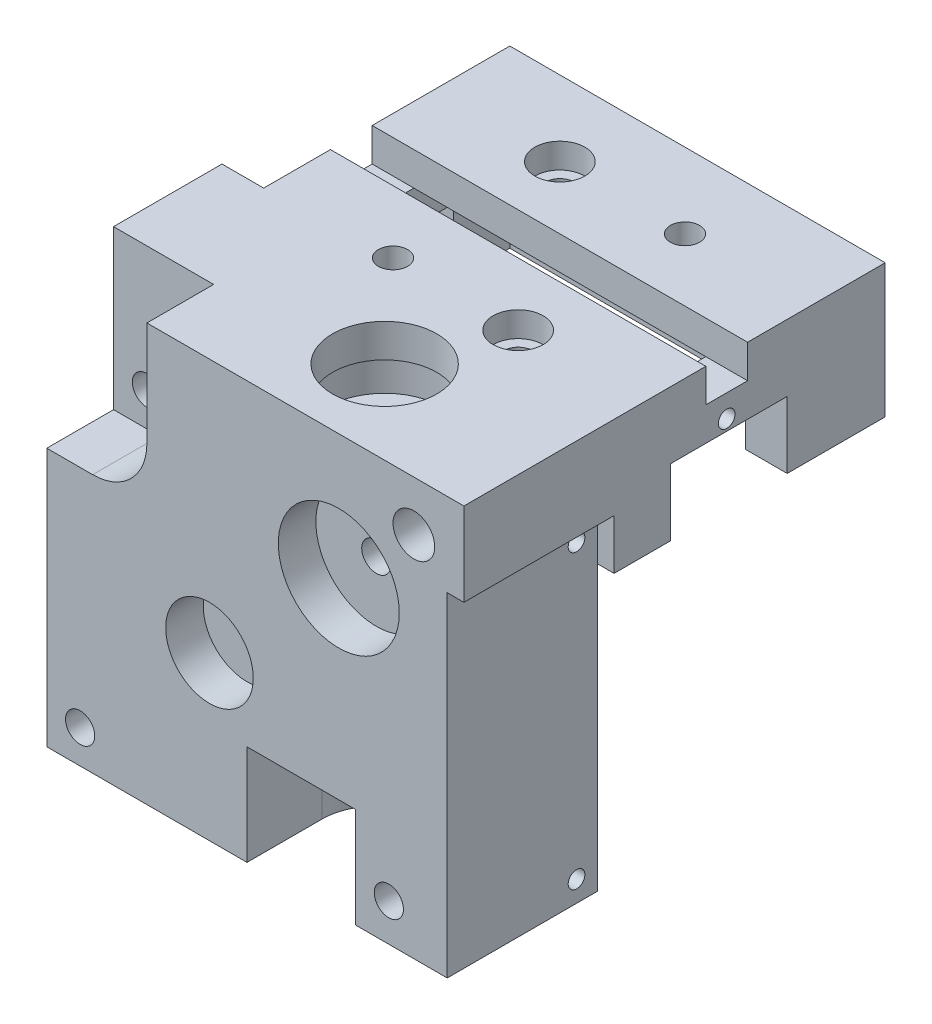
from build123d import *

# Parameters (mm, degrees)
SKETCH1_W                       = 35
SKETCH1_H                       = 28
BOSS_EXTRUDE1_DEPTH             = 4
SKETCH2_R                       = 1.75
CUT_EXTRUDE1_DEPTH              = 23.765104876
BOSS_EXTRUDE2_DEPTH             = 17.5
BOSS_EXTRUDE2_DEPTH_BACK        = 0.5
SKETCH3_W                       = 35
SKETCH3_H                       = 50
SKETCH7_W                       = 35
SKETCH7_H                       = 37
BOSS_EXTRUDE3_DEPTH             = 5
SKETCH10_R                      = 1.75
CUT_EXTRUDE6_DEPTH              = 5
SKETCH24_W                      = 18
SKETCH24_H                      = 46
BOSS_EXTRUDE4_DEPTH             = 10
SKETCH37_W                      = 13
SKETCH37_H                      = 14
BOSS_EXTRUDE9_DEPTH             = 10
CUT_EXTRUDE19_REACH             = 75.638
SKETCH22_R                      = 1.75
SKETCH22_3_R                    = 7.25
SKETCH22_3_R_2                  = 5.25
CUT_EXTRUDE20_DEPTH             = 4.5
SKETCH22_5_R                    = 1.75
SKETCH22_5_W                    = 2
SKETCH22_5_H                    = 4
CUT_EXTRUDE24_DEPTH             = 8
SKETCH22_4_W                    = 13
SKETCH22_4_H                    = 12
CUT_EXTRUDE21_DEPTH             = 15.5
FILLET3_R                       = 6.5
SKETCH26_R                      = 2.25
CUT_EXTRUDE22_DEPTH             = 57.502212346
SKETCH27_R                      = 6.25
CUT_EXTRUDE23_DEPTH             = 8
BOSS_EXTRUDE11_DEPTH            = 5
BOSS_EXTRUDE12_DEPTH            = 5
SKETCH29_R                      = 2.5
CUT_EXTRUDE25_DEPTH             = 5
CUT_EXTRUDE25_DIRECTION_2_REACH = 64.678
SKETCH55_R                      = 2.75
CUT_EXTRUDE42_DEPTH             = 10
SKETCH30_R                      = 3
CUT_EXTRUDE26_DEPTH             = 3
SKETCH38_R                      = 7
CUT_EXTRUDE31_DEPTH             = 4
SKETCH39_W                      = 5
SKETCH39_H                      = 13
SKETCH39_W_2                    = 4
SKETCH39_H_2                    = 7
CUT_EXTRUDE32_DEPTH             = 3
SKETCH40_R                      = 1.75
CUT_EXTRUDE33_DEPTH             = 15
SKETCH51_R                      = 2.5
CUT_EXTRUDE38_DEPTH             = 4
SKETCH42_R                      = 1.4
CUT_EXTRUDE34_DEPTH             = 10
SKETCH45_R                      = 1
CUT_EXTRUDE35_DEPTH             = 75.888250122
SKETCH46_R                      = 1.5
BOSS_EXTRUDE13_DEPTH            = 2.5
SKETCH48_W                      = 18
SKETCH48_H                      = 40
CUT_EXTRUDE36_DEPTH             = 2
SKETCH49_R                      = 1
CUT_EXTRUDE37_DEPTH             = 10
SKETCH53_W                      = 45
SKETCH53_H                      = 5
CUT_EXTRUDE40_DEPTH             = 4
SKETCH54_W                      = 5
SKETCH54_H                      = 21
CUT_EXTRUDE41_DEPTH             = 72.64670269
SKETCH56_R                      = 2.5
CUT_EXTRUDE43_DEPTH             = 8


with BuildPart() as part:
    # Sketch1 → Boss-Extrude1 (new body)
    with BuildSketch(Plane(origin=(0, 0, 0), x_dir=(1, 0, 0), z_dir=(0, 1, 0))):
        Rectangle(SKETCH1_W, SKETCH1_H)
    extrude(amount=BOSS_EXTRUDE1_DEPTH)

    # Sketch2 → Cut-Extrude1 (cut, through all)
    with BuildSketch(Plane(origin=(0, 4, 0), x_dir=(1, 0, 0), z_dir=(0, 1, 0))):
        with Locations(Location((-7.5, -10, 0), (0, 0, 270))):
            Circle(SKETCH2_R)
        with Locations(Location((-7.5, 10, 0), (0, 0, 270))):
            Circle(SKETCH2_R)
        with Locations(Location((7.5, -10, 0), (0, 0, 270))):
            Circle(SKETCH2_R)
        with Locations(Location((7.5, 10, 0), (0, 0, 270))):
            Circle(SKETCH2_R)
    extrude(amount=-CUT_EXTRUDE1_DEPTH, mode=Mode.SUBTRACT)

    # Sketch3 → Boss-Extrude2 (add, two sides: drawn at the far end of the back side and taken through both)
    with BuildSketch(Plane.XY.offset(14).offset(-BOSS_EXTRUDE2_DEPTH_BACK)):
        with Locations((0, -21)):
            Rectangle(SKETCH3_W, SKETCH3_H)
    extrude(amount=BOSS_EXTRUDE2_DEPTH + BOSS_EXTRUDE2_DEPTH_BACK)

    # Sketch7 → Boss-Extrude3 (add)
    with BuildSketch(Plane(origin=(0, 0, -14), x_dir=(-1, 0, 0), z_dir=(0, 0, -1))):
        with Locations((0, -14.5)):
            Rectangle(SKETCH7_W, SKETCH7_H)
    extrude(amount=BOSS_EXTRUDE3_DEPTH)

    # Sketch10 → Cut-Extrude6 (cut)
    with BuildSketch(Plane(origin=(0, 0, -19), x_dir=(-1, 0, 0), z_dir=(0, 0, -1))):
        with Locations((-5, -30)):
            Circle(SKETCH10_R)
        with Locations((5, -30)):
            Circle(SKETCH10_R)
    extrude(amount=-CUT_EXTRUDE6_DEPTH, mode=Mode.SUBTRACT)

    # Sketch24 → Boss-Extrude4 (add)
    with BuildSketch(Plane.ZY.offset(17.5)):
        with Locations((22.5, -23)):
            Rectangle(SKETCH24_W, SKETCH24_H)
    extrude(amount=BOSS_EXTRUDE4_DEPTH)

    # Sketch37 → Boss-Extrude9 (add)
    with BuildSketch(Plane.ZY.offset(17.5)):
        with Locations((17, -3)):
            Rectangle(SKETCH37_W, SKETCH37_H)
    extrude(amount=BOSS_EXTRUDE9_DEPTH)

    # Sketch22 → Cut-Extrude19 (cut, up to next)
    with BuildSketch(Plane.XY.offset(31.5), mode=Mode.PRIVATE) as cut_extrude19_sk1:
        with Locations((-23.5, -42)):
            Circle(SKETCH22_R)
    cut_extrude19_tool1 = extrude(cut_extrude19_sk1.sketch, amount=-CUT_EXTRUDE19_REACH, mode=Mode.PRIVATE) & part.part
    # Sketch22 → Cut-Extrude19 (cut, up to next)
    with BuildSketch(Plane.XY.offset(31.5), mode=Mode.PRIVATE) as cut_extrude19_sk2:
        with Locations((13.5, -41.5)):
            Circle(SKETCH22_R)
    cut_extrude19_tool2 = extrude(cut_extrude19_sk2.sketch, amount=-CUT_EXTRUDE19_REACH, mode=Mode.PRIVATE) & part.part
    # Sketch22 → Cut-Extrude19 (cut, up to next)
    with BuildSketch(Plane.XY.offset(31.5), mode=Mode.PRIVATE) as cut_extrude19_sk3:
        with Locations((7.5, -11)):
            Circle(SKETCH22_R)
    cut_extrude19_tool3 = extrude(cut_extrude19_sk3.sketch, amount=-CUT_EXTRUDE19_REACH, mode=Mode.PRIVATE) & part.part
    # Sketch22 → Cut-Extrude19 (cut, up to next)
    with BuildSketch(Plane.XY.offset(31.5), mode=Mode.PRIVATE) as cut_extrude19_sk4:
        with Locations((-23.5, -11)):
            Circle(SKETCH22_R)
    cut_extrude19_tool4 = extrude(cut_extrude19_sk4.sketch, amount=-CUT_EXTRUDE19_REACH, mode=Mode.PRIVATE) & part.part
    add(cut_extrude19_tool1.solids().sort_by_distance((-23.5, -42, 31.5))[0], mode=Mode.SUBTRACT)
    add(cut_extrude19_tool2.solids().sort_by_distance((13.5, -41.5, 31.5))[0], mode=Mode.SUBTRACT)
    add(cut_extrude19_tool3.solids().sort_by_distance((7.5, -11, 31.5))[0], mode=Mode.SUBTRACT)
    add(cut_extrude19_tool4.solids().sort_by_distance((-23.5, -11, 31.5))[0], mode=Mode.SUBTRACT)

    # Sketch22<3> → Cut-Extrude20 (cut)
    with BuildSketch(Plane.XY.offset(31.5)):
        with Locations((7.5, -11)):
            Circle(SKETCH22_3_R)
        with Locations((-8, -26.5)):
            Circle(SKETCH22_3_R_2)
    extrude(amount=-CUT_EXTRUDE20_DEPTH, mode=Mode.SUBTRACT)

    # Sketch22<5> → Cut-Extrude24 (cut)
    # profile 1 of 2: a face of its own
    with BuildSketch(Plane.XY.offset(31.5)):
        with BuildLine():
            Line((-15.5, -8.5), (-15.5, 0))
            Line((-15.5, 0), (-17.5, 0))
            Line((-17.5, 0), (-27.5, 0))
            Line((-27.5, 0), (-27.5, -15))
            Line((-27.5, -15), (-22, -15))
            ThreePointArc((-22, -15), (-17.403805922, -13.096194078), (-15.5, -8.5))
        make_face()
        with Locations((-23.5, -11)):
            Circle(SKETCH22_5_R, mode=Mode.SUBTRACT)
    # profile 2 of 2: a face of its own
    with BuildSketch(Plane.XY.offset(31.5)):
        with Locations((-16.5, 2)):
            Rectangle(SKETCH22_5_W, SKETCH22_5_H)
    extrude(amount=-CUT_EXTRUDE24_DEPTH, mode=Mode.SUBTRACT)

    # Sketch22<4> → Cut-Extrude21 (cut)
    with BuildSketch(Plane.XY.offset(31.5)):
        with Locations((3, -40)):
            Rectangle(SKETCH22_4_W, SKETCH22_4_H)
    extrude(amount=-CUT_EXTRUDE21_DEPTH, mode=Mode.SUBTRACT)

    # Fillet3
    fillet3_edges = [part.edges().sort_by_distance(p)[0] for p in [
        (9.5, -40, 16),
        (-3.5, -40, 16),
    ]]
    fillet(fillet3_edges, radius=FILLET3_R - 0.0001)  # a hair under: the kernel refuses the full size

    # Sketch26 → Cut-Extrude22 (cut, through all)
    with BuildSketch(Plane.XZ.offset(34)):
        with Locations(Location((3, 21.5, 0), (0, 0, 270))):
            Circle(SKETCH26_R)
    extrude(amount=-CUT_EXTRUDE22_DEPTH, mode=Mode.SUBTRACT)

    # Sketch27 → Cut-Extrude23 (cut)
    with BuildSketch(Plane(origin=(0, 4, 0), x_dir=(1, 0, 0), z_dir=(0, 1, 0))):
        with Locations(Location((3, -21.5, 0), (0, 0, 270))):
            Circle(SKETCH27_R)
    extrude(amount=-CUT_EXTRUDE23_DEPTH, mode=Mode.SUBTRACT)

    # Sketch43 → Boss-Extrude11 (add)
    with BuildSketch(Plane(origin=(17.5, 0, 0), x_dir=(0, 0, -1), z_dir=(1, 0, 0))):
        Polygon((-31.5, -46), (-31.5, 4), (19, 4), (19, -33), (14, -33), (14, -12), (7.25, -12), (7.25, -4), (-6.75, -4), (-6.75, -12), (-13.5, -12), (-13.5, -46), align=None)
    extrude(amount=BOSS_EXTRUDE11_DEPTH)

    # Sketch44 → Boss-Extrude12 (add)
    with BuildSketch(Plane.ZY.offset(17.5)):
        Polygon((10.5, 4), (-19, 4), (-19, -33), (-14, -33), (-14, -12), (-7.25, -12), (-7.25, -4), (6.75, -4), (6.75, -12), (13.5, -12), (13.5, -10), (10.5, -10), align=None)
    extrude(amount=BOSS_EXTRUDE12_DEPTH)

    # Sketch29 → Cut-Extrude25 (cut)
    with BuildSketch(Plane(origin=(0, 0, 13.5), x_dir=(-1, 0, 0), z_dir=(0, 0, -1))):
        with Locations(Location((-7.5, -11, 0), (0, 0, 180))):
            Circle(SKETCH29_R)
        with Locations(Location((23.5, -42, 0), (0, 0, 180))):
            Circle(SKETCH29_R)
        with Locations(Location((23.5, -11, 0), (0, 0, 203.578178478))):
            Circle(SKETCH29_R)
    extrude(amount=-CUT_EXTRUDE25_DEPTH, mode=Mode.SUBTRACT)

    # Cut-Extrude25 direction 2: up to this face of the body (flat: up to its plane)
    cut_extrude25_direction_2_end = Plane(part.part.faces().sort_by_distance((-20, -8, 6.75))[0])
    # Sketch29 → Cut-Extrude25 direction 2 (cut, up to the picked face)
    with BuildSketch(Plane(origin=(0, 0, 13.5), x_dir=(-1, 0, 0), z_dir=(0, 0, -1)), mode=Mode.PRIVATE) as cut_extrude25_direction_2_sk1:
        with Locations(Location((-7.5, -11, 0), (0, 0, 180))):
            Circle(SKETCH29_R)
    cut_extrude25_direction_2_tool1 = split(extrude(cut_extrude25_direction_2_sk1.sketch, amount=CUT_EXTRUDE25_DIRECTION_2_REACH, mode=Mode.PRIVATE), bisect_by=cut_extrude25_direction_2_end, keep=Keep.BOTH, mode=Mode.PRIVATE)
    # Sketch29 → Cut-Extrude25 direction 2 (cut, up to the picked face)
    with BuildSketch(Plane(origin=(0, 0, 13.5), x_dir=(-1, 0, 0), z_dir=(0, 0, -1)), mode=Mode.PRIVATE) as cut_extrude25_direction_2_sk2:
        with Locations(Location((23.5, -42, 0), (0, 0, 180))):
            Circle(SKETCH29_R)
    cut_extrude25_direction_2_tool2 = split(extrude(cut_extrude25_direction_2_sk2.sketch, amount=CUT_EXTRUDE25_DIRECTION_2_REACH, mode=Mode.PRIVATE), bisect_by=cut_extrude25_direction_2_end, keep=Keep.BOTH, mode=Mode.PRIVATE)
    # Sketch29 → Cut-Extrude25 direction 2 (cut, up to the picked face)
    with BuildSketch(Plane(origin=(0, 0, 13.5), x_dir=(-1, 0, 0), z_dir=(0, 0, -1)), mode=Mode.PRIVATE) as cut_extrude25_direction_2_sk3:
        with Locations(Location((23.5, -11, 0), (0, 0, 203.578178478))):
            Circle(SKETCH29_R)
    cut_extrude25_direction_2_tool3 = split(extrude(cut_extrude25_direction_2_sk3.sketch, amount=CUT_EXTRUDE25_DIRECTION_2_REACH, mode=Mode.PRIVATE), bisect_by=cut_extrude25_direction_2_end, keep=Keep.BOTH, mode=Mode.PRIVATE)
    add(cut_extrude25_direction_2_tool1.solids().sort_by(Axis((7.5, -11, 13.5), (0, 0, -1)))[0], mode=Mode.SUBTRACT)
    add(cut_extrude25_direction_2_tool2.solids().sort_by(Axis((-23.5, -42, 13.5), (0, 0, -1)))[0], mode=Mode.SUBTRACT)
    add(cut_extrude25_direction_2_tool3.solids().sort_by(Axis((-23.5, -11, 13.5), (0, 0, -1)))[0], mode=Mode.SUBTRACT)

    # Sketch55 → Cut-Extrude42 (cut)
    with BuildSketch(Plane(origin=(0, 0, 13.5), x_dir=(-1, 0, 0), z_dir=(0, 0, -1))):
        with Locations((-13.5, -41.5)):
            Circle(SKETCH55_R)
    extrude(amount=-CUT_EXTRUDE42_DEPTH, mode=Mode.SUBTRACT)

    # Sketch30 → Cut-Extrude26 (cut)
    with BuildSketch(Plane(origin=(0, 4, 0), x_dir=(1, 0, 0), z_dir=(0, 1, 0))):
        with Locations(Location((-7.5, 10, 0), (0, 0, 270))):
            Circle(SKETCH30_R)
        with Locations(Location((7.5, -10, 0), (0, 0, 270))):
            Circle(SKETCH30_R)
    extrude(amount=-CUT_EXTRUDE26_DEPTH, mode=Mode.SUBTRACT)

    # Sketch38 → Cut-Extrude31 (cut)
    with BuildSketch(Plane(origin=(0, -4, 0), x_dir=(1, 0, 0), z_dir=(0, 1, 0))):
        with Locations(Location((3, -21.5, 0), (0, 0, 308.213210702))):
            Circle(SKETCH38_R)
    extrude(amount=CUT_EXTRUDE31_DEPTH, mode=Mode.SUBTRACT)

    # Sketch39 → Cut-Extrude32 (cut)
    with BuildSketch(Plane.ZY.offset(27.5)):
        with Locations((16, -32.5)):
            Rectangle(SKETCH39_W, SKETCH39_H)
        with Locations((25.5, -32.5)):
            Rectangle(SKETCH39_W_2, SKETCH39_H_2)
    extrude(amount=-CUT_EXTRUDE32_DEPTH, mode=Mode.SUBTRACT)

    # Sketch40 → Cut-Extrude33 (cut)
    with BuildSketch(Plane.ZY.offset(27.5)):
        with Locations((17, -22.5)):
            Circle(SKETCH40_R)
    extrude(amount=-CUT_EXTRUDE33_DEPTH, mode=Mode.SUBTRACT)

    # Sketch51 → Cut-Extrude38 (cut)
    with BuildSketch(Plane.ZY.offset(27.5)):
        with Locations((17, -22.5)):
            Circle(SKETCH51_R)
    extrude(amount=-CUT_EXTRUDE38_DEPTH, mode=Mode.SUBTRACT)

    # Sketch42 → Cut-Extrude34 (cut)
    with BuildSketch(Plane.XY.offset(31.5)):
        with Locations((16.5, -2)):
            Circle(SKETCH42_R)
    extrude(amount=-CUT_EXTRUDE34_DEPTH, mode=Mode.SUBTRACT)

    # Sketch45 → Cut-Extrude35 (cut, through all)
    with BuildSketch(Plane(origin=(22.5, 0, 0), x_dir=(0, 0, -1), z_dir=(1, 0, 0))):
        with Locations((0, -2.7)):
            Circle(SKETCH45_R)
    extrude(amount=-CUT_EXTRUDE35_DEPTH, mode=Mode.SUBTRACT)

    # Sketch46 → Boss-Extrude13 (add)
    with BuildSketch(Plane.ZY.offset(27.5)):
        with Locations(Location((17, -42.5, 0), (0, 0, 180))):
            Circle(SKETCH46_R)
    extrude(amount=BOSS_EXTRUDE13_DEPTH)

    # Sketch48 → Cut-Extrude36 (cut)
    with BuildSketch(Plane(origin=(22.5, 0, 0), x_dir=(0, 0, -1), z_dir=(1, 0, 0))):
        with Locations((-22.5, -26)):
            Rectangle(SKETCH48_W, SKETCH48_H)
    extrude(amount=-CUT_EXTRUDE36_DEPTH, mode=Mode.SUBTRACT)

    # Sketch49 → Cut-Extrude37 (cut)
    with BuildSketch(Plane(origin=(20.5, 0, 0), x_dir=(0, 0, -1), z_dir=(1, 0, 0))):
        with Locations((-16, -43.5)):
            Circle(SKETCH49_R)
        with Locations((-16, -8.5)):
            Circle(SKETCH49_R)
    extrude(amount=-CUT_EXTRUDE37_DEPTH, mode=Mode.SUBTRACT)

    # Sketch53 → Cut-Extrude40 (cut)
    with BuildSketch(Plane(origin=(0, 4, 0), x_dir=(1, 0, 0), z_dir=(0, 1, 0))):
        Rectangle(SKETCH53_W, SKETCH53_H)
    extrude(amount=-CUT_EXTRUDE40_DEPTH, mode=Mode.SUBTRACT)

    # Sketch54 → Cut-Extrude41 (cut, through all)
    with BuildSketch(Plane.ZY.offset(22.5)):
        with Locations((-16.5, -22.5)):
            Rectangle(SKETCH54_W, SKETCH54_H)
    extrude(amount=-CUT_EXTRUDE41_DEPTH, mode=Mode.SUBTRACT)

    # Sketch56 → Cut-Extrude43 (cut)
    with BuildSketch(Plane.XY.offset(31.5)):
        with Locations((16.5, -2)):
            Circle(SKETCH56_R)
    extrude(amount=-CUT_EXTRUDE43_DEPTH, mode=Mode.SUBTRACT)


solid = part.part
